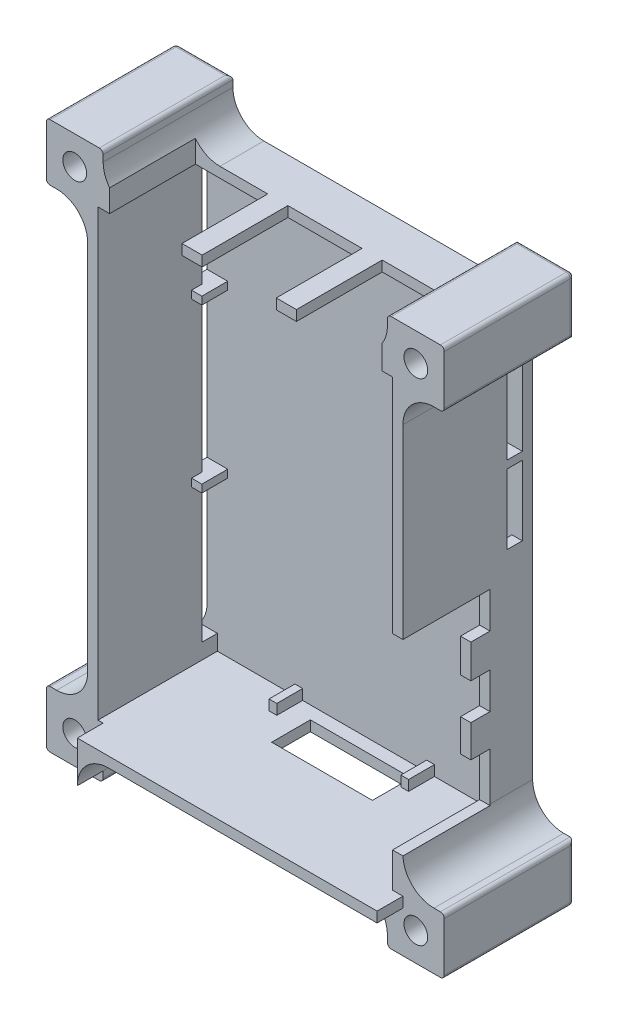
from build123d import *

# Parameters (mm, degrees)
SKETCH1_W            = 61
SKETCH1_H            = 90
BOSS_EXTRUDE1_DEPTH  = 2
SKETCH2_W            = 61
SKETCH2_H            = 90
SKETCH2_W_2          = 57
SKETCH2_H_2          = 86
BOSS_EXTRUDE2_DEPTH  = 6.6
SKETCH3_W            = 1.5
SKETCH3_H            = 2
SKETCH3_W_2          = 2
SKETCH3_H_2          = 1.5
BOSS_EXTRUDE3_DEPTH  = 5
SKETCH4_W            = 61
SKETCH4_H            = 90
SKETCH4_W_2          = 57
SKETCH4_H_2          = 86
BOSS_EXTRUDE4_DEPTH  = 16.5
SKETCH5_W            = 14.35
SKETCH5_H            = 16.6
SKETCH5_W_2          = 14
CUT_EXTRUDE1_DEPTH   = 2
SKETCH7_W            = 3
SKETCH7_H            = 35
CUT_EXTRUDE2_DEPTH   = 2
SKETCH8_W            = 19.5
SKETCH8_H            = 7.5
CUT_EXTRUDE3_DEPTH   = 2
SKETCH9_W            = 3
SKETCH9_H            = 80
CUT_EXTRUDE4_DEPTH   = 2
SKETCH10_W           = 61
SKETCH10_H           = 2
BOSS_EXTRUDE5_DEPTH  = 5
SKETCH12_W           = 3
SKETCH12_H           = 1.5
BOSS_EXTRUDE6_DEPTH  = 2
SKETCH13_W           = 3
SKETCH13_H           = 1.5
BOSS_EXTRUDE7_DEPTH  = 2
SKETCH20_W           = 11
SKETCH20_H           = 11
BOSS_EXTRUDE8_DEPTH  = 25.1
SKETCH25_W           = 11
SKETCH25_H           = 11
SKETCH25_W_2         = 0.25
CUT_EXTRUDE11_DEPTH  = 123.454113855
SKETCH26_W           = 1
SKETCH26_H           = 1
CUT_EXTRUDE12_DEPTH  = 23.1
SKETCH27_R           = 2.3
CUT_EXTRUDE13_DEPTH  = 123.454113855
CUT_EXTRUDE17_DEPTH  = 6
FILLET3_R            = 6
FILLET4_R            = 6
SKETCH33_W           = 0.250000008
SKETCH33_H           = 2
BOSS_EXTRUDE10_DEPTH = 5
FILLET7_R            = 6
FILLET8_R            = 6
BOSS_EXTRUDE11_DEPTH = 25.1
SKETCH35_R           = 2.3
CUT_EXTRUDE18_DEPTH  = 123.454113855
FILLET9_R            = 6
FILLET10_R           = 6
FILLET11_R           = 6
FILLET12_R           = 6
FILLET13_R           = 0.75
CUT_EXTRUDE19_DEPTH  = 6


with BuildPart() as part:
    # Sketch1 → Boss-Extrude1 (new body)
    with BuildSketch(Plane.XY):
        with Locations((30.5, 45)):
            Rectangle(SKETCH1_W, SKETCH1_H)
    extrude(amount=BOSS_EXTRUDE1_DEPTH)

    # Sketch2 → Boss-Extrude2 (add)
    with BuildSketch(Plane.XY.offset(2)):
        with Locations((30.5, 45)):
            Rectangle(SKETCH2_W, SKETCH2_H)
        with Locations((30.5, 45)):
            Rectangle(SKETCH2_W_2, SKETCH2_H_2, mode=Mode.SUBTRACT)
    extrude(amount=BOSS_EXTRUDE2_DEPTH)

    # Sketch3 → Boss-Extrude3 (add)
    with BuildSketch(Plane.XY.offset(2)):
        with Locations((43.25, 3)):
            Rectangle(SKETCH3_W, SKETCH3_H)
        with Locations((17.75, 3)):
            Rectangle(SKETCH3_W, SKETCH3_H)
        with Locations((3, 32.75)):
            Rectangle(SKETCH3_W_2, SKETCH3_H_2)
        with Locations((58, 32.75)):
            Rectangle(SKETCH3_W_2, SKETCH3_H_2)
        with Locations((58, 64.25)):
            Rectangle(SKETCH3_W_2, SKETCH3_H_2)
        with Locations((3, 64.25)):
            Rectangle(SKETCH3_W_2, SKETCH3_H_2)
    extrude(amount=BOSS_EXTRUDE3_DEPTH)

    # Sketch4 → Boss-Extrude4 (add)
    with BuildSketch(Plane.XY.offset(8.6)):
        with Locations((30.5, 45)):
            Rectangle(SKETCH4_W, SKETCH4_H)
        with Locations((30.5, 45)):
            Rectangle(SKETCH4_W_2, SKETCH4_H_2, mode=Mode.SUBTRACT)
    extrude(amount=BOSS_EXTRUDE4_DEPTH)

    # Sketch5 → Cut-Extrude1 (cut)
    with BuildSketch(Plane(origin=(0, 90, 0), x_dir=(1, 0, 0), z_dir=(0, 1, 0))):
        Polygon((57, -8.5), (40.4, -8.5), (40.4, -22.25), (40.4, -25.1), (57, -25.1), align=None)
        with Locations((29.325, -16.8)):
            Rectangle(SKETCH5_W, SKETCH5_H)
        with Locations((11.25, -16.8)):
            Rectangle(SKETCH5_W_2, SKETCH5_H)
    extrude(amount=-CUT_EXTRUDE1_DEPTH, mode=Mode.SUBTRACT)

    # Sketch7 → Cut-Extrude2 (cut)
    with BuildSketch(Plane(origin=(61, 0, 0), x_dir=(0, 0, -1), z_dir=(1, 0, 0))):
        Polygon((-11.95, 18.25), (-11.95, 24.5), (-8.25, 24.5), (-8.25, 31.5), (-11.95, 31.5), (-11.95, 38), (-8.25, 38), (-8.25, 45), (-25.1, 45), (-25.1, 8.75), (-8.25, 8.75), (-8.25, 18.25), align=None)
        with Locations((-3.5, 67.5)):
            Rectangle(SKETCH7_W, SKETCH7_H)
    extrude(amount=-CUT_EXTRUDE2_DEPTH, mode=Mode.SUBTRACT)

    # Sketch8 → Cut-Extrude3 (cut)
    with BuildSketch(Plane(origin=(0, 0, 0), x_dir=(-1, 0, 0), z_dir=(0, -1, 0))):
        with Locations((-32.25, -8.25)):
            Rectangle(SKETCH8_W, SKETCH8_H)
    extrude(amount=-CUT_EXTRUDE3_DEPTH, mode=Mode.SUBTRACT)

    # Sketch9 → Cut-Extrude4 (cut)
    with BuildSketch(Plane.ZY):
        with Locations((3.5, 45)):
            Rectangle(SKETCH9_W, SKETCH9_H)
    extrude(amount=-CUT_EXTRUDE4_DEPTH, mode=Mode.SUBTRACT)

    # Sketch10 → Boss-Extrude5 (add)
    with BuildSketch(Plane.XY.offset(25.1)):
        with Locations((30.5, 1)):
            Rectangle(SKETCH10_W, SKETCH10_H)
    extrude(amount=BOSS_EXTRUDE5_DEPTH)

    # Sketch12 → Boss-Extrude6 (add)
    with BuildSketch(Plane.ZY.offset(-2)):
        with Locations((3.5, 64.25)):
            Rectangle(SKETCH12_W, SKETCH12_H)
        with Locations((3.5, 32.75)):
            Rectangle(SKETCH12_W, SKETCH12_H)
    extrude(amount=BOSS_EXTRUDE6_DEPTH)

    # Sketch13 → Boss-Extrude7 (add)
    with BuildSketch(Plane(origin=(59, 0, 0), x_dir=(0, 0, -1), z_dir=(1, 0, 0))):
        with Locations((-3.5, 64.25)):
            Rectangle(SKETCH13_W, SKETCH13_H)
    extrude(amount=BOSS_EXTRUDE7_DEPTH)

    # Sketch20 → Boss-Extrude8 (add)
    with BuildSketch(Plane(origin=(0, 0, 0), x_dir=(-1, 0, 0), z_dir=(0, 0, -1))):
        with Locations((2.5, -2.5)):
            Rectangle(SKETCH20_W, SKETCH20_H)
        with Locations((-63.5, 92.5)):
            Rectangle(SKETCH20_W, SKETCH20_H)
    extrude(amount=-BOSS_EXTRUDE8_DEPTH)

    # Sketch25 → Cut-Extrude11 (cut, through all)
    with BuildSketch(Plane.XY.offset(25.1)):
        with Locations((-2.5, -2.5)):
            Rectangle(SKETCH25_W, SKETCH25_H)
        with Locations((3.125, -2.5)):
            Rectangle(SKETCH25_W_2, SKETCH25_H)
    extrude(amount=CUT_EXTRUDE11_DEPTH, mode=Mode.SUBTRACT)

    # Sketch26 → Cut-Extrude12 (cut)
    with BuildSketch(Plane.XY.offset(25.1)):
        with Locations((2.5, 2.5)):
            Rectangle(SKETCH26_W, SKETCH26_H)
        with Locations((58.5, 87.5)):
            Rectangle(SKETCH26_W, SKETCH26_H)
    extrude(amount=-CUT_EXTRUDE12_DEPTH, mode=Mode.SUBTRACT)

    # Sketch27 → Cut-Extrude13 (cut, through all)
    with BuildSketch(Plane.XY.offset(25.1)):
        with Locations((-2.5, -2.5)):
            Circle(SKETCH27_R)
        with Locations((63.5, 92.5)):
            Circle(SKETCH27_R)
    extrude(amount=-CUT_EXTRUDE13_DEPTH, mode=Mode.SUBTRACT)

    # Sketch31 → Cut-Extrude17 (cut)
    with BuildSketch(Plane(origin=(0, 0, 0), x_dir=(-1, 0, 0), z_dir=(0, 0, -1))):
        Polygon((-60.873056275, 87.95), (-58.24611255, 92.5), (-60.873056275, 97.05), (-66.126943725, 97.05), (-68.75388745, 92.5), (-66.126943725, 87.95), align=None)
        Polygon((4.775, -6.440415587), (7.05, -2.5), (4.775, 1.440415587), (0.225, 1.440415587), (-2.05, -2.5), (0.225, -6.440415587), align=None)
    extrude(amount=-CUT_EXTRUDE17_DEPTH, mode=Mode.SUBTRACT)

    # Fillet3
    fillet3_edges = [part.edges().sort_by_distance(p)[0] for p in [
        (58, 90, 12.55),
    ]]
    fillet(fillet3_edges, radius=FILLET3_R)

    # Fillet4
    # the kernel refuses this fillet: 6 mm, written as the material it adds along each edge
    with BuildSketch(Plane(origin=(61, 87, 25.1), x_dir=(1, 0, 0), z_dir=(0, 0, -1))) as fillet4_piece_1_section:
        with BuildLine():
            CenterArc((FILLET4_R, FILLET4_R), FILLET4_R, 180, 90)
            Line((0, FILLET4_R), (0, 0))
            Line((0, 0), (FILLET4_R, 0))
        make_face()
    fillet4_piece_1 = extrude(amount=25.1, mode=Mode.PRIVATE)
    fillet4_piece_1 = split(fillet4_piece_1, bisect_by=Plane(origin=(62.717195646, 85, 15.05), z_dir=(0, 1, 0)), keep=Keep.TOP, mode=Mode.PRIVATE)
    fillet4_piece_1 = split(fillet4_piece_1, bisect_by=Plane(origin=(62.717195646, 86.286018652, 5), z_dir=(0, 0, 1)), keep=Keep.TOP, mode=Mode.PRIVATE)
    add(fillet4_piece_1)
    with BuildSketch(Plane(origin=(61, 87, 25.1), x_dir=(1, 0, 0), z_dir=(0, 0, -1))) as fillet4_piece_2_section:
        with BuildLine():
            CenterArc((FILLET4_R, FILLET4_R), FILLET4_R, 180, 90)
            Line((0, FILLET4_R), (0, 0))
            Line((0, 0), (FILLET4_R, 0))
        make_face()
    fillet4_piece_2 = extrude(amount=25.1, mode=Mode.PRIVATE)
    fillet4_piece_2 = split(fillet4_piece_2, bisect_by=Plane(origin=(61.345040637, 85, 15.05), z_dir=(0, -1, 0)), keep=Keep.TOP, mode=Mode.PRIVATE)
    fillet4_piece_2 = split(fillet4_piece_2, bisect_by=Plane(origin=(61.345040637, 83.82185881, 5), z_dir=(0, 0, 1)), keep=Keep.TOP, mode=Mode.PRIVATE)
    add(fillet4_piece_2)
    with BuildSketch(Plane(origin=(61, 87, 25.1), x_dir=(1, 0, 0), z_dir=(0, 0, -1))) as fillet4_piece_3_section:
        with BuildLine():
            CenterArc((FILLET4_R, FILLET4_R), FILLET4_R, 180, 90)
            Line((0, FILLET4_R), (0, 0))
            Line((0, 0), (FILLET4_R, 0))
        make_face()
    fillet4_piece_3 = extrude(amount=25.1, mode=Mode.PRIVATE)
    fillet4_piece_3 = split(fillet4_piece_3, bisect_by=Plane(origin=(62.717195646, 86.286018652, 2), z_dir=(0, 0, 1)), keep=Keep.TOP, mode=Mode.PRIVATE)
    fillet4_piece_3 = split(fillet4_piece_3, bisect_by=Plane(origin=(62.717195646, 85, 3.5), z_dir=(0, 1, 0)), keep=Keep.TOP, mode=Mode.PRIVATE)
    fillet4_piece_3 = split(fillet4_piece_3, bisect_by=Plane(origin=(62.717195646, 86.286018652, 5), z_dir=(0, 0, -1)), keep=Keep.TOP, mode=Mode.PRIVATE)
    add(fillet4_piece_3)
    with BuildSketch(Plane(origin=(61, 87, 25.1), x_dir=(1, 0, 0), z_dir=(0, 0, -1))) as fillet4_piece_4_section:
        with BuildLine():
            CenterArc((FILLET4_R, FILLET4_R), FILLET4_R, 180, 90)
            Line((0, FILLET4_R), (0, 0))
            Line((0, 0), (FILLET4_R, 0))
        make_face()
    fillet4_piece_4 = extrude(amount=25.1, mode=Mode.PRIVATE)
    fillet4_piece_4 = split(fillet4_piece_4, bisect_by=Plane(origin=(62.717195646, 86.286018652, 2), z_dir=(0, 0, -1)), keep=Keep.TOP, mode=Mode.PRIVATE)
    fillet4_piece_4 = split(fillet4_piece_4, bisect_by=Plane(origin=(62.717195646, 85, 1), z_dir=(0, 1, 0)), keep=Keep.TOP, mode=Mode.PRIVATE)
    add(fillet4_piece_4)
    with BuildSketch(Plane(origin=(61, 87, 25.1), x_dir=(1, 0, 0), z_dir=(0, 0, -1))) as fillet4_piece_5_section:
        with BuildLine():
            CenterArc((FILLET4_R, FILLET4_R), FILLET4_R, 180, 90)
            Line((0, FILLET4_R), (0, 0))
            Line((0, 0), (FILLET4_R, 0))
        make_face()
    fillet4_piece_5 = extrude(amount=25.1, mode=Mode.PRIVATE)
    fillet4_piece_5 = split(fillet4_piece_5, bisect_by=Plane(origin=(61.345040637, 83.82185881, 2), z_dir=(0, 0, -1)), keep=Keep.TOP, mode=Mode.PRIVATE)
    fillet4_piece_5 = split(fillet4_piece_5, bisect_by=Plane(origin=(61.345040637, 85, 1), z_dir=(0, -1, 0)), keep=Keep.TOP, mode=Mode.PRIVATE)
    add(fillet4_piece_5)

    # Sketch33 → Boss-Extrude10 (add)
    with BuildSketch(Plane.XY.offset(25.1)):
        with Locations((3.124999996, 1)):
            Rectangle(SKETCH33_W, SKETCH33_H)
    extrude(amount=BOSS_EXTRUDE10_DEPTH)

    # Fillet7
    # the kernel refuses this fillet: 6 mm, written as the material it adds along each edge
    with BuildSketch(Plane(origin=(3, 0, 0), x_dir=(0, -1, 0), z_dir=(0, 0, 1))) as fillet7_piece_1_section:
        with BuildLine():
            CenterArc((FILLET7_R, FILLET7_R), FILLET7_R, 180, 90)
            Line((0, FILLET7_R), (0, 0))
            Line((0, 0), (FILLET7_R, 0))
        make_face()
    fillet7_piece_1 = extrude(amount=25.1, mode=Mode.PRIVATE)
    fillet7_piece_1 = split(fillet7_piece_1, bisect_by=Plane(origin=(2.999999992, -1.220838783, 12.55), z_dir=(1, 0, 0)), keep=Keep.TOP, mode=Mode.PRIVATE)
    add(fillet7_piece_1)
    with BuildSketch(Plane(origin=(3, 0, 0), x_dir=(0, -1, 0), z_dir=(0, 0, 1))) as fillet7_piece_2_section:
        with BuildLine():
            CenterArc((FILLET7_R, FILLET7_R), FILLET7_R, 180, 90)
            Line((0, FILLET7_R), (0, 0))
            Line((0, 0), (FILLET7_R, 0))
        make_face()
    fillet7_piece_2 = extrude(amount=40.1, mode=Mode.PRIVATE)
    fillet7_piece_2 = split(fillet7_piece_2, bisect_by=Plane(origin=(4.481706294, -1.220838783, 25.1), z_dir=(0, 0, 1)), keep=Keep.TOP, mode=Mode.PRIVATE)
    fillet7_piece_2 = split(fillet7_piece_2, bisect_by=Plane(origin=(2.999999992, -1.220838783, 27.6), z_dir=(1, 0, 0)), keep=Keep.TOP, mode=Mode.PRIVATE)
    fillet7_piece_2 = split(fillet7_piece_2, bisect_by=Plane(origin=(4.481706294, -1.220838783, 30.1), z_dir=(0, 0, -1)), keep=Keep.TOP, mode=Mode.PRIVATE)
    add(fillet7_piece_2)

    # Fillet8
    # the kernel refuses this fillet: 6 mm, written as the material it adds along each edge
    with BuildSketch(Plane(origin=(0, 3, 25.1), x_dir=(0, 1, 0), z_dir=(0, 0, -1))) as fillet8_piece_1_section:
        with BuildLine():
            CenterArc((FILLET8_R, -FILLET8_R), FILLET8_R, 90, 90)
            Line((0, -FILLET8_R), (0, 0))
            Line((0, 0), (FILLET8_R, 0))
        make_face()
    fillet8_piece_1 = extrude(amount=25.1, mode=Mode.PRIVATE)
    fillet8_piece_1 = split(fillet8_piece_1, bisect_by=Plane(origin=(-0.345040637, 6.17814119, 5), z_dir=(0, 0, 1)), keep=Keep.TOP, mode=Mode.PRIVATE)
    fillet8_piece_1 = split(fillet8_piece_1, bisect_by=Plane(origin=(-0.345040637, 5, 15.05), z_dir=(0, 1, 0)), keep=Keep.TOP, mode=Mode.PRIVATE)
    add(fillet8_piece_1)
    with BuildSketch(Plane(origin=(0, 3, 25.1), x_dir=(0, 1, 0), z_dir=(0, 0, -1))) as fillet8_piece_2_section:
        with BuildLine():
            CenterArc((FILLET8_R, -FILLET8_R), FILLET8_R, 90, 90)
            Line((0, -FILLET8_R), (0, 0))
            Line((0, 0), (FILLET8_R, 0))
        make_face()
    fillet8_piece_2 = extrude(amount=25.1, mode=Mode.PRIVATE)
    fillet8_piece_2 = split(fillet8_piece_2, bisect_by=Plane(origin=(-1.717195646, 3.713981348, 5), z_dir=(0, 0, 1)), keep=Keep.TOP, mode=Mode.PRIVATE)
    fillet8_piece_2 = split(fillet8_piece_2, bisect_by=Plane(origin=(-1.717195646, 5, 15.05), z_dir=(0, -1, 0)), keep=Keep.TOP, mode=Mode.PRIVATE)
    add(fillet8_piece_2)
    with BuildSketch(Plane(origin=(0, 3, 25.1), x_dir=(0, 1, 0), z_dir=(0, 0, -1))) as fillet8_piece_3_section:
        with BuildLine():
            CenterArc((FILLET8_R, -FILLET8_R), FILLET8_R, 90, 90)
            Line((0, -FILLET8_R), (0, 0))
            Line((0, 0), (FILLET8_R, 0))
        make_face()
    fillet8_piece_3 = extrude(amount=25.1, mode=Mode.PRIVATE)
    fillet8_piece_3 = split(fillet8_piece_3, bisect_by=Plane(origin=(-1.717195646, 3.713981348, 5), z_dir=(0, 0, -1)), keep=Keep.TOP, mode=Mode.PRIVATE)
    fillet8_piece_3 = split(fillet8_piece_3, bisect_by=Plane(origin=(-1.717195646, 5, 3.5), z_dir=(0, -1, 0)), keep=Keep.TOP, mode=Mode.PRIVATE)
    fillet8_piece_3 = split(fillet8_piece_3, bisect_by=Plane(origin=(-1.717195646, 3.713981348, 2), z_dir=(0, 0, 1)), keep=Keep.TOP, mode=Mode.PRIVATE)
    add(fillet8_piece_3)
    with BuildSketch(Plane(origin=(0, 3, 25.1), x_dir=(0, 1, 0), z_dir=(0, 0, -1))) as fillet8_piece_4_section:
        with BuildLine():
            CenterArc((FILLET8_R, -FILLET8_R), FILLET8_R, 90, 90)
            Line((0, -FILLET8_R), (0, 0))
            Line((0, 0), (FILLET8_R, 0))
        make_face()
    fillet8_piece_4 = extrude(amount=25.1, mode=Mode.PRIVATE)
    fillet8_piece_4 = split(fillet8_piece_4, bisect_by=Plane(origin=(-0.345040637, 5, 1), z_dir=(0, 1, 0)), keep=Keep.TOP, mode=Mode.PRIVATE)
    fillet8_piece_4 = split(fillet8_piece_4, bisect_by=Plane(origin=(-0.345040637, 6.17814119, 2), z_dir=(0, 0, -1)), keep=Keep.TOP, mode=Mode.PRIVATE)
    add(fillet8_piece_4)
    with BuildSketch(Plane(origin=(0, 3, 25.1), x_dir=(0, 1, 0), z_dir=(0, 0, -1))) as fillet8_piece_5_section:
        with BuildLine():
            CenterArc((FILLET8_R, -FILLET8_R), FILLET8_R, 90, 90)
            Line((0, -FILLET8_R), (0, 0))
            Line((0, 0), (FILLET8_R, 0))
        make_face()
    fillet8_piece_5 = extrude(amount=25.1, mode=Mode.PRIVATE)
    fillet8_piece_5 = split(fillet8_piece_5, bisect_by=Plane(origin=(-1.717195646, 5, 1), z_dir=(0, -1, 0)), keep=Keep.TOP, mode=Mode.PRIVATE)
    fillet8_piece_5 = split(fillet8_piece_5, bisect_by=Plane(origin=(-1.717195646, 3.713981348, 2), z_dir=(0, 0, -1)), keep=Keep.TOP, mode=Mode.PRIVATE)
    add(fillet8_piece_5)

    # Sketch34 → Boss-Extrude11 (add)
    with BuildSketch(Plane.XY.offset(25.1)):
        Polygon((59, 3), (69, 3), (69, -8), (58, -8), (58, 2), (59, 2), align=None)
        Polygon((2, 87), (-8, 87), (-8, 98), (3, 98), (3, 88), (2, 88), align=None)
    extrude(amount=-BOSS_EXTRUDE11_DEPTH)

    # Sketch35 → Cut-Extrude18 (cut, through all)
    with BuildSketch(Plane.XY.offset(25.1)):
        with Locations((-2.5, 92.5)):
            Circle(SKETCH35_R)
        with Locations((63.5, -2.5)):
            Circle(SKETCH35_R)
    extrude(amount=-CUT_EXTRUDE18_DEPTH, mode=Mode.SUBTRACT)

    # Fillet9
    # the kernel refuses this fillet: 6 mm, written as the material it adds along each edge
    with BuildSketch(Plane(origin=(0, 87, 0), x_dir=(0, -1, 0), z_dir=(0, 0, 1))) as fillet9_piece_1_section:
        with BuildLine():
            CenterArc((FILLET9_R, -FILLET9_R), FILLET9_R, 90, 90)
            Line((0, -FILLET9_R), (0, 0))
            Line((0, 0), (FILLET9_R, 0))
        make_face()
    fillet9_piece_1 = extrude(amount=25.1, mode=Mode.PRIVATE)
    fillet9_piece_1 = split(fillet9_piece_1, bisect_by=Plane(origin=(-0.345040637, 85, 1), z_dir=(0, -1, 0)), keep=Keep.TOP, mode=Mode.PRIVATE)
    fillet9_piece_1 = split(fillet9_piece_1, bisect_by=Plane(origin=(-0.345040637, 83.82185881, 2), z_dir=(0, 0, -1)), keep=Keep.TOP, mode=Mode.PRIVATE)
    add(fillet9_piece_1)
    with BuildSketch(Plane(origin=(0, 87, 0), x_dir=(0, -1, 0), z_dir=(0, 0, 1))) as fillet9_piece_2_section:
        with BuildLine():
            CenterArc((FILLET9_R, -FILLET9_R), FILLET9_R, 90, 90)
            Line((0, -FILLET9_R), (0, 0))
            Line((0, 0), (FILLET9_R, 0))
        make_face()
    fillet9_piece_2 = extrude(amount=25.1, mode=Mode.PRIVATE)
    fillet9_piece_2 = split(fillet9_piece_2, bisect_by=Plane(origin=(-1.717195646, 85, 1), z_dir=(0, 1, 0)), keep=Keep.TOP, mode=Mode.PRIVATE)
    fillet9_piece_2 = split(fillet9_piece_2, bisect_by=Plane(origin=(-1.717195646, 86.286018652, 2), z_dir=(0, 0, -1)), keep=Keep.TOP, mode=Mode.PRIVATE)
    add(fillet9_piece_2)
    with BuildSketch(Plane(origin=(0, 87, 0), x_dir=(0, -1, 0), z_dir=(0, 0, 1))) as fillet9_piece_3_section:
        with BuildLine():
            CenterArc((FILLET9_R, -FILLET9_R), FILLET9_R, 90, 90)
            Line((0, -FILLET9_R), (0, 0))
            Line((0, 0), (FILLET9_R, 0))
        make_face()
    fillet9_piece_3 = extrude(amount=25.1, mode=Mode.PRIVATE)
    fillet9_piece_3 = split(fillet9_piece_3, bisect_by=Plane(origin=(-1.717195646, 86.286018652, 5), z_dir=(0, 0, -1)), keep=Keep.TOP, mode=Mode.PRIVATE)
    fillet9_piece_3 = split(fillet9_piece_3, bisect_by=Plane(origin=(-1.717195646, 85, 3.5), z_dir=(0, 1, 0)), keep=Keep.TOP, mode=Mode.PRIVATE)
    fillet9_piece_3 = split(fillet9_piece_3, bisect_by=Plane(origin=(-1.717195646, 86.286018652, 2), z_dir=(0, 0, 1)), keep=Keep.TOP, mode=Mode.PRIVATE)
    add(fillet9_piece_3)
    with BuildSketch(Plane(origin=(0, 87, 0), x_dir=(0, -1, 0), z_dir=(0, 0, 1))) as fillet9_piece_4_section:
        with BuildLine():
            CenterArc((FILLET9_R, -FILLET9_R), FILLET9_R, 90, 90)
            Line((0, -FILLET9_R), (0, 0))
            Line((0, 0), (FILLET9_R, 0))
        make_face()
    fillet9_piece_4 = extrude(amount=25.1, mode=Mode.PRIVATE)
    fillet9_piece_4 = split(fillet9_piece_4, bisect_by=Plane(origin=(-0.345040637, 83.82185881, 5), z_dir=(0, 0, 1)), keep=Keep.TOP, mode=Mode.PRIVATE)
    fillet9_piece_4 = split(fillet9_piece_4, bisect_by=Plane(origin=(-0.345040637, 85, 15.05), z_dir=(0, -1, 0)), keep=Keep.TOP, mode=Mode.PRIVATE)
    add(fillet9_piece_4)
    with BuildSketch(Plane(origin=(0, 87, 0), x_dir=(0, -1, 0), z_dir=(0, 0, 1))) as fillet9_piece_5_section:
        with BuildLine():
            CenterArc((FILLET9_R, -FILLET9_R), FILLET9_R, 90, 90)
            Line((0, -FILLET9_R), (0, 0))
            Line((0, 0), (FILLET9_R, 0))
        make_face()
    fillet9_piece_5 = extrude(amount=25.1, mode=Mode.PRIVATE)
    fillet9_piece_5 = split(fillet9_piece_5, bisect_by=Plane(origin=(-1.717195646, 86.286018652, 5), z_dir=(0, 0, 1)), keep=Keep.TOP, mode=Mode.PRIVATE)
    fillet9_piece_5 = split(fillet9_piece_5, bisect_by=Plane(origin=(-1.717195646, 85, 15.05), z_dir=(0, 1, 0)), keep=Keep.TOP, mode=Mode.PRIVATE)
    add(fillet9_piece_5)

    # Fillet10
    fillet10_edges = [part.edges().sort_by_distance(p)[0] for p in [
        (3, 90, 12.55),
    ]]
    fillet(fillet10_edges, radius=FILLET10_R)

    # Fillet11
    fillet11_edges = [part.edges().sort_by_distance(p)[0] for p in [
        (61, 3, 12.55),
    ]]
    fillet(fillet11_edges, radius=FILLET11_R)

    # Fillet12
    fillet12_edges = [part.edges().sort_by_distance(p)[0] for p in [
        (58, 0, 12.55),
    ]]
    fillet(fillet12_edges, radius=FILLET12_R)

    # Fillet13
    # the kernel refuses this fillet: 0.75 mm, written as the material it takes off along each edge
    with BuildSketch(Plane(origin=(-7.25, -7.25, 0.75), x_dir=(-1, 0, 0), z_dir=(0, 0, -1))) as fillet13_piece_1_section:
        Polygon((0, 0), (FILLET13_R, 0), (FILLET13_R, -FILLET13_R), (0, -FILLET13_R), align=None)
    fillet13_piece_1 = extrude(amount=FILLET13_R, mode=Mode.PRIVATE)
    fillet13_piece_1 = fillet13_piece_1 - Plane(origin=(-7.25, -7.25, 0.75), x_dir=(0.7071067811865476, 0.7071067811865475, 0), z_dir=(0, 0, -1)) * Sphere(FILLET13_R, mode=Mode.PRIVATE)
    add(fillet13_piece_1, mode=Mode.SUBTRACT)
    with BuildSketch(Plane(origin=(68.25, 97.25, 0.75), x_dir=(0, 1, 0), z_dir=(0, 0, -1))) as fillet13_piece_2_section:
        Polygon((0, 0), (FILLET13_R, 0), (FILLET13_R, FILLET13_R), (0, FILLET13_R), align=None)
    fillet13_piece_2 = extrude(amount=FILLET13_R, mode=Mode.PRIVATE)
    fillet13_piece_2 = fillet13_piece_2 - Plane(origin=(68.25, 97.25, 0.75), x_dir=(-0.707106781186548, -0.707106781186547, 0), z_dir=(0, 0, -1)) * Sphere(FILLET13_R, mode=Mode.PRIVATE)
    add(fillet13_piece_2, mode=Mode.SUBTRACT)
    with BuildSketch(Plane(origin=(68.25, -7.25, 0.75), x_dir=(0, -1, 0), z_dir=(0, 0, -1))) as fillet13_piece_3_section:
        Polygon((0, 0), (FILLET13_R, 0), (FILLET13_R, -FILLET13_R), (0, -FILLET13_R), align=None)
    fillet13_piece_3 = extrude(amount=FILLET13_R, mode=Mode.PRIVATE)
    fillet13_piece_3 = fillet13_piece_3 - Plane(origin=(68.25, -7.25, 0.75), x_dir=(-0.7071067811865475, 0.7071067811865475, 0), z_dir=(0, 0, -1)) * Sphere(FILLET13_R, mode=Mode.PRIVATE)
    add(fillet13_piece_3, mode=Mode.SUBTRACT)
    with BuildSketch(Plane(origin=(-7.25, 97.25, 0.75), x_dir=(0, 1, 0), z_dir=(0, 0, -1))) as fillet13_piece_4_section:
        Polygon((0, 0), (FILLET13_R, 0), (FILLET13_R, -FILLET13_R), (0, -FILLET13_R), align=None)
    fillet13_piece_4 = extrude(amount=FILLET13_R, mode=Mode.PRIVATE)
    fillet13_piece_4 = fillet13_piece_4 - Plane(origin=(-7.25, 97.25, 0.75), x_dir=(0.7071067811865475, -0.7071067811865475, 0), z_dir=(0, 0, -1)) * Sphere(FILLET13_R, mode=Mode.PRIVATE)
    add(fillet13_piece_4, mode=Mode.SUBTRACT)
    with BuildSketch(Plane(origin=(3, -8, -1.875), x_dir=(-1, 0, 0), z_dir=(0, 0, 1)), Plane(origin=(-8, 3, -1.875), x_dir=(1, 0, 0), z_dir=(0, 0, 1)), Plane(origin=(58, -8, 26.975), x_dir=(1, 0, 0), z_dir=(0, 0, -1)), Plane(origin=(69, 3, 26.975), x_dir=(-1, 0, 0), z_dir=(0, 0, -1))) as fillet13_piece_5:
        with BuildLine():
            CenterArc((FILLET13_R, -FILLET13_R), FILLET13_R, 90, 90)
            Line((0, -FILLET13_R), (0, 0))
            Line((0, 0), (FILLET13_R, 0))
        make_face()
    extrude(amount=28.85, mode=Mode.SUBTRACT)
    with BuildSketch(Plane(origin=(-7.25, -8, 0), x_dir=(0, 1, 0), z_dir=(1, 0, 0)), Plane(origin=(-8, 4.875, 0), x_dir=(1, 0, 0), z_dir=(0, -1, 0)), Plane(origin=(68.25, 98, 0), x_dir=(0, -1, 0), z_dir=(-1, 0, 0)), Plane(origin=(69, 85.125, 0), x_dir=(-1, 0, 0), z_dir=(0, 1, 0))) as fillet13_piece_6:
        with BuildLine():
            CenterArc((FILLET13_R, FILLET13_R), FILLET13_R, 180, 90)
            Line((0, FILLET13_R), (0, 0))
            Line((0, 0), (FILLET13_R, 0))
        make_face()
    extrude(amount=12.125, mode=Mode.SUBTRACT)
    with BuildSketch(Plane(origin=(-8, -8, 0.75), x_dir=(0, 1, 0), z_dir=(0, 0, 1)), Plane(origin=(69, -8, 26.975), x_dir=(0, 1, 0), z_dir=(0, 0, -1))) as fillet13_piece_7:
        with BuildLine():
            CenterArc((FILLET13_R, -FILLET13_R), FILLET13_R, 90, 90)
            Line((0, -FILLET13_R), (0, 0))
            Line((0, 0), (FILLET13_R, 0))
        make_face()
    extrude(amount=26.225, mode=Mode.SUBTRACT)
    with BuildSketch(Plane(origin=(58, 98, -1.875), x_dir=(0, -1, 0), z_dir=(0, 0, 1)), Plane(origin=(69, 87, -1.875), x_dir=(0, 1, 0), z_dir=(0, 0, 1)), Plane(origin=(3, 98, 26.975), x_dir=(0, -1, 0), z_dir=(0, 0, -1)), Plane(origin=(-8, 87, 26.975), x_dir=(0, 1, 0), z_dir=(0, 0, -1))) as fillet13_piece_8:
        with BuildLine():
            CenterArc((FILLET13_R, FILLET13_R), FILLET13_R, 180, 90)
            Line((0, FILLET13_R), (0, 0))
            Line((0, 0), (FILLET13_R, 0))
        make_face()
    extrude(amount=28.85, mode=Mode.SUBTRACT)
    with BuildSketch(Plane(origin=(69, 98, 0.75), x_dir=(-1, 0, 0), z_dir=(0, 0, 1)), Plane(origin=(-8, 98, 26.975), x_dir=(1, 0, 0), z_dir=(0, 0, -1))) as fillet13_piece_9:
        with BuildLine():
            CenterArc((FILLET13_R, FILLET13_R), FILLET13_R, 180, 90)
            Line((0, FILLET13_R), (0, 0))
            Line((0, 0), (FILLET13_R, 0))
        make_face()
    extrude(amount=26.225, mode=Mode.SUBTRACT)
    with BuildSketch(Plane(origin=(68.25, -8, 0), x_dir=(0, 1, 0), z_dir=(-1, 0, 0)), Plane(origin=(69, 4.875, 0), x_dir=(-1, 0, 0), z_dir=(0, -1, 0)), Plane(origin=(-7.25, 98, 0), x_dir=(0, -1, 0), z_dir=(1, 0, 0)), Plane(origin=(-8, 85.125, 0), x_dir=(1, 0, 0), z_dir=(0, 1, 0))) as fillet13_piece_10:
        with BuildLine():
            CenterArc((FILLET13_R, -FILLET13_R), FILLET13_R, 90, 90)
            Line((0, -FILLET13_R), (0, 0))
            Line((0, 0), (FILLET13_R, 0))
        make_face()
    extrude(amount=12.125, mode=Mode.SUBTRACT)

    # Sketch36 → Cut-Extrude19 (cut)
    with BuildSketch(Plane(origin=(0, 0, 0), x_dir=(-1, 0, 0), z_dir=(0, 0, -1))):
        Polygon((-58.95, -2.5), (-61.225, 1.440415587), (-65.775, 1.440415587), (-68.05, -2.5), (-65.775, -6.440415587), (-61.225, -6.440415587), align=None)
        Polygon((-2.05, 92.5), (0.225, 88.559584413), (4.775, 88.559584413), (7.05, 92.5), (4.775, 96.440415587), (0.225, 96.440415587), align=None)
    extrude(amount=-CUT_EXTRUDE19_DEPTH, mode=Mode.SUBTRACT)


solid = part.part
